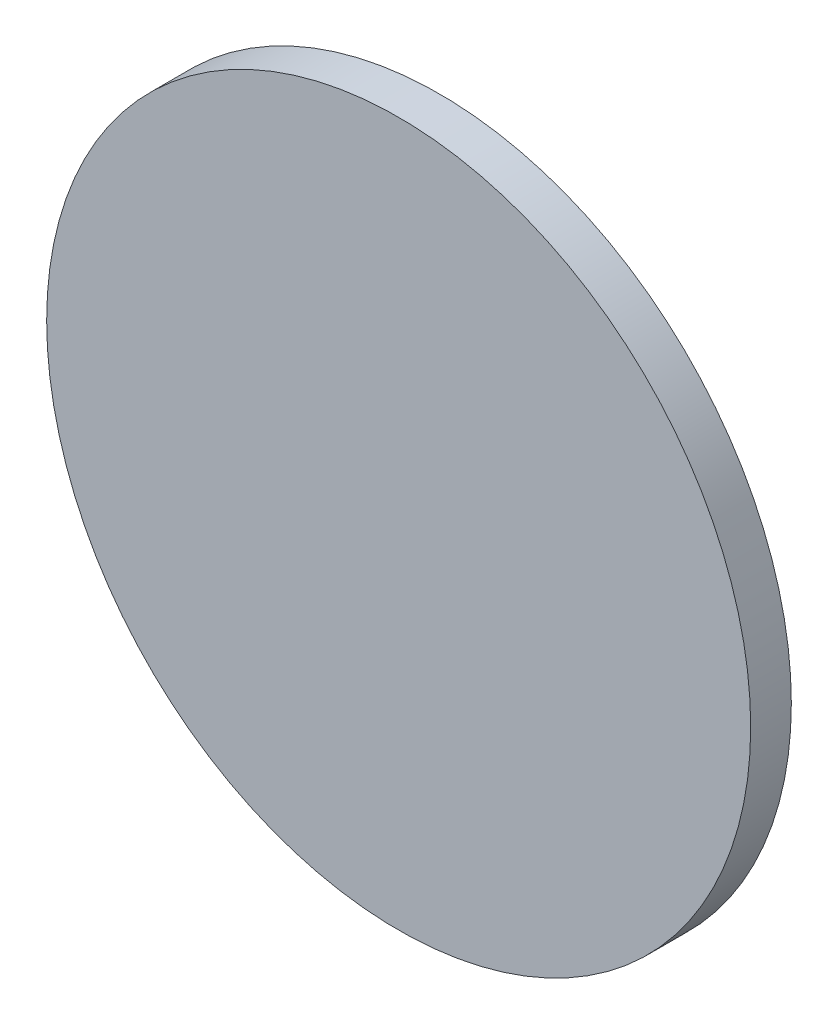
from build123d import *

# Parameters (mm, degrees)
SKETCH1_R           = 27.5
BOSS_EXTRUDE1_DEPTH = 3.175


with BuildPart() as part:
    # Sketch1 → Boss-Extrude1 (new body)
    with BuildSketch(Plane.XY):
        Circle(SKETCH1_R)
    extrude(amount=BOSS_EXTRUDE1_DEPTH)


solid = part.part
